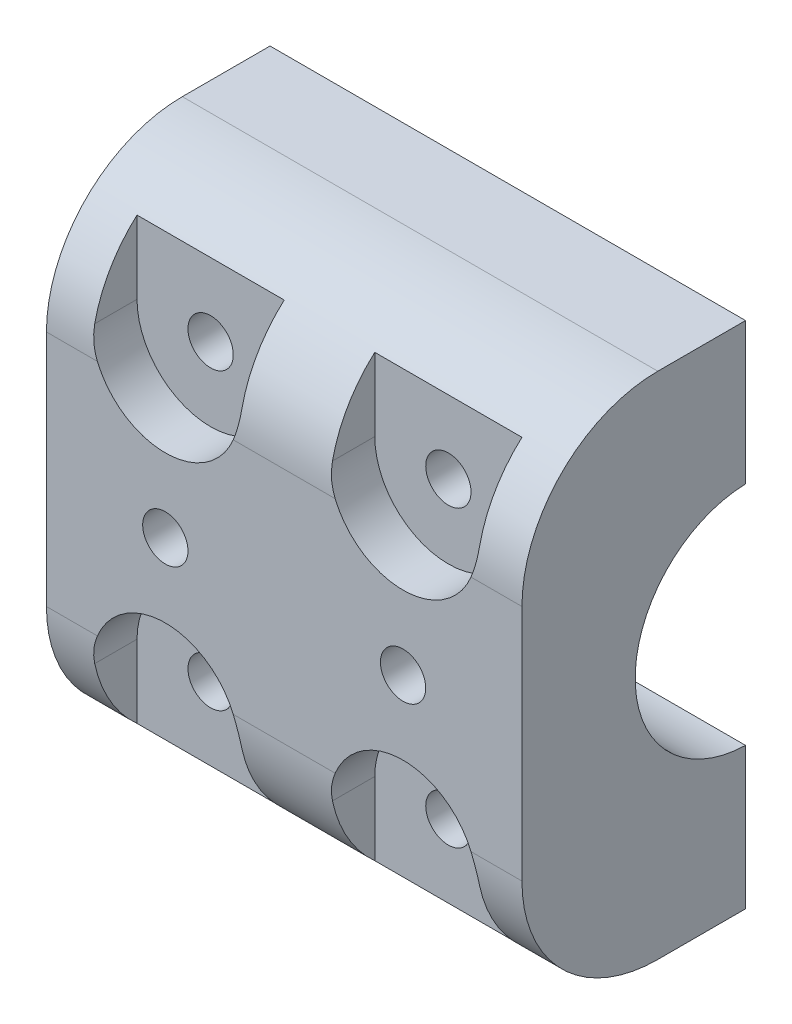
from build123d import *

# Parameters (mm, degrees)
BOSS_EXTRUDE1_DEPTH = 42
SKETCH2_R           = 2
CUT_EXTRUDE2_DEPTH  = 52.578217301
CUT_EXTRUDE3_DEPTH  = 4
SKETCH4_R           = 2
CUT_EXTRUDE4_DEPTH  = 52.578217427


with BuildPart() as part:
    # Sketch1 → Boss-Extrude1 (new body)
    with BuildSketch(Plane(origin=(0, 0, 0), x_dir=(0, 0, -1), z_dir=(1, 0, 0))):
        with BuildLine():
            Line((-0.25, 9.996874512), (-0.25, 22.5))
            Line((-0.25, 22.5), (-3, 22.5))
            Line((-3, 22.5), (-8, 22.5))
            ThreePointArc((-8, 22.5), (-16.485281374, 18.985281374), (-20, 10.5))
            Line((-20, 10.5), (-20, -10.5))
            ThreePointArc((-20, -10.5), (-16.485281374, -18.985281374), (-8, -22.5))
            Line((-8, -22.5), (-3, -22.5))
            Line((-3, -22.5), (-0.25, -22.5))
            Line((-0.25, -22.5), (-0.25, -9.996874512))
            ThreePointArc((-0.25, -9.996874512), (-10, 0), (-0.25, 9.996874512))
        make_face()
    extrude(amount=-BOSS_EXTRUDE1_DEPTH)

    # Sketch2 → Cut-Extrude2 (cut, through all)
    with BuildSketch(Plane.XY.offset(0.25)):
        with Locations((-31.5, 13)):
            Circle(SKETCH2_R)
        with Locations((-10.5, 13)):
            Circle(SKETCH2_R)
        with Locations((-10.5, -13)):
            Circle(SKETCH2_R)
        with Locations((-31.5, -13)):
            Circle(SKETCH2_R)
    extrude(amount=CUT_EXTRUDE2_DEPTH, mode=Mode.SUBTRACT)

    # Sketch3 → Cut-Extrude3 (cut)
    with BuildSketch(Plane.XY.offset(20)):
        with BuildLine():
            Line((-38, 13), (-38, 19.5))
            Line((-38, 19.5), (-25, 19.5))
            Line((-25, 19.5), (-25, 13))
            ThreePointArc((-25, 13), (-31.5, 6.5), (-38, 13))
        make_face()
        with BuildLine():
            Line((-17, 13), (-17, 19.5))
            Line((-17, 19.5), (-4, 19.5))
            Line((-4, 19.5), (-4, 13))
            ThreePointArc((-4, 13), (-10.5, 6.5), (-17, 13))
        make_face()
        with BuildLine():
            Line((-4, -19.5), (-4, -13))
            ThreePointArc((-4, -13), (-10.5, -6.5), (-17, -13))
            Line((-17, -13), (-17, -19.5))
            Line((-17, -19.5), (-4, -19.5))
        make_face()
        with BuildLine():
            Line((-25, -19.5), (-25, -13))
            ThreePointArc((-25, -13), (-31.5, -6.5), (-38, -13))
            Line((-38, -13), (-38, -19.5))
            Line((-38, -19.5), (-25, -19.5))
        make_face()
    extrude(amount=-CUT_EXTRUDE3_DEPTH, mode=Mode.SUBTRACT)

    # Sketch4 → Cut-Extrude4 (cut, through all)
    with BuildSketch(Plane.XY.offset(20)):
        with Locations((-10.5, 0)):
            Circle(SKETCH4_R)
        with Locations((-31.5, 0)):
            Circle(SKETCH4_R)
    extrude(amount=-CUT_EXTRUDE4_DEPTH, mode=Mode.SUBTRACT)


solid = part.part
